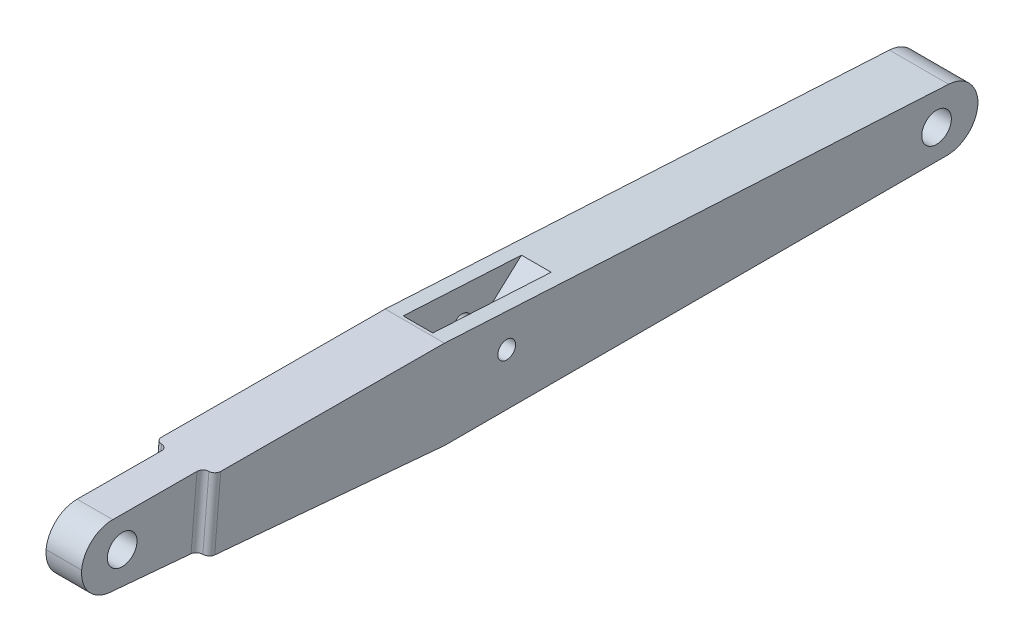
from build123d import *

# Parameters (mm, degrees)
SKETCH2_W           = 10
SKETCH2_H           = 90
BOSS_EXTRUDE1_DEPTH = 10
SKETCH3_W           = 10
SKETCH3_H           = 60
BOSS_EXTRUDE2_DEPTH = 10
BOSS_EXTRUDE3_DEPTH = 10
CUT_EXTRUDE5_START  = -8
CUT_EXTRUDE5_DEPTH  = 2
CUT_EXTRUDE6_DEPTH  = 2
SKETCH4_3_R         = 2.5
CUT_EXTRUDE1_DEPTH  = 10
CUT_EXTRUDE2_START  = -2.5
SKETCH4_5_R         = 1.5
CUT_EXTRUDE2_DEPTH  = 5
CUT_EXTRUDE3_DEPTH  = 107.338519192
FILLET3_R           = 5.25
FILLET4_R           = 5.25
SKETCH4_7_R         = 2.5
CUT_EXTRUDE4_DEPTH  = 106.904850242
FILLET5_R           = 1


# Some blends are built 0.0001 mm under size
with BuildPart() as part:
    # Sketch2 → Boss-Extrude1 (new body)
    with BuildSketch(Plane(origin=(0, 0, 0), x_dir=(1, 0, 0), z_dir=(0, 1, 0))):
        Rectangle(SKETCH2_W, SKETCH2_H)
    extrude(amount=BOSS_EXTRUDE1_DEPTH)

    # Sketch3 → Boss-Extrude2 (add)
    with BuildSketch(Plane(origin=(0, -3.907083998, 0.341825557), x_dir=(1, 0, 0), z_dir=(0, -0.9961946980917459, 0.08715574274765504))):
        with Locations((0, 74.828761414)):
            Rectangle(SKETCH3_W, SKETCH3_H)
    extrude(amount=-BOSS_EXTRUDE2_DEPTH)

    # Sketch4 → Boss-Extrude3 (add)
    with BuildSketch(Plane(origin=(5, 0, 0), x_dir=(0, 0, -1), z_dir=(1, 0, 0))):
        Polygon((-103.900124458, 15.191291546), (-44.563390571, 10), (45, 10), (-45.073853215, 14.973874535), align=None)
    extrude(amount=-BOSS_EXTRUDE3_DEPTH)

    # Sketch6 → Cut-Extrude5 (cut)
    with BuildSketch(Plane(origin=(5, 0, 0), x_dir=(0, 0, -1), z_dir=(1, 0, 0)).offset(CUT_EXTRUDE5_START)):
        Polygon((-103.900124458, 15.191291546), (-104.771681886, 5.229344565), (-84.847787924, 3.48622971), (-83.830217328, 15.117114837), align=None)
    extrude(amount=-CUT_EXTRUDE5_DEPTH, mode=Mode.SUBTRACT)

    # Sketch6<2> → Cut-Extrude6 (cut)
    with BuildSketch(Plane(origin=(5, 0, 0), x_dir=(0, 0, -1), z_dir=(1, 0, 0))):
        Polygon((-103.900124458, 15.191291546), (-104.771681886, 5.229344565), (-84.847787924, 3.48622971), (-83.830217328, 15.117114837), align=None)
    extrude(amount=-CUT_EXTRUDE6_DEPTH, mode=Mode.SUBTRACT)

    # Sketch4<3> → Cut-Extrude1 (cut)
    with BuildSketch(Plane(origin=(5, 0, 0), x_dir=(0, 0, -1), z_dir=(1, 0, 0))):
        with Locations((-97.467522719, 10)):
            Circle(SKETCH4_3_R)
    extrude(amount=-CUT_EXTRUDE1_DEPTH, mode=Mode.SUBTRACT)

    # Sketch4<5> → Cut-Extrude2 (cut)
    with BuildSketch(Plane(origin=(5, 0, 0), x_dir=(0, 0, -1), z_dir=(1, 0, 0)).offset(CUT_EXTRUDE2_START)):
        with BuildLine():
            Line((-44.537121893, 14.944236253), (-36.742124975, 6.709179338))
            ThreePointArc((-36.742124975, 6.709179338), (-34.672491645, 5.773472347), (-32.540320007, 6.556271045))
            Line((-32.540320007, 6.556271045), (-24.563390571, 13.841287616))
            Line((-24.563390571, 13.841287616), (-44.537121893, 14.944236253))
        make_face()
        with Locations((-34.563390571, 8.77148785)):
            Circle(SKETCH4_5_R, mode=Mode.SUBTRACT)
    extrude(amount=-CUT_EXTRUDE2_DEPTH, mode=Mode.SUBTRACT)

    # Sketch4<6> → Cut-Extrude3 (cut, through all)
    with BuildSketch(Plane(origin=(5, 0, 0), x_dir=(0, 0, -1), z_dir=(1, 0, 0))):
        with BuildLine():
            ThreePointArc((-33.702717638, 10), (-34.563390571, 10.27148785), (-35.424063503, 10))
            Line((-35.424063503, 10), (-33.702717638, 10))
        make_face()
        with BuildLine():
            Line((-33.702717638, 10), (-35.424063503, 10))
            ThreePointArc((-35.424063503, 10), (-35.255846563, 7.440884716), (-33.063390571, 8.77148785))
            ThreePointArc((-33.063390571, 8.77148785), (-33.232787437, 9.463943842), (-33.702717638, 10))
        make_face()
    extrude(amount=-CUT_EXTRUDE3_DEPTH, mode=Mode.SUBTRACT)

    # Fillet3
    # the kernel refuses this fillet: 5.25 mm, written as the material it takes off along each edge
    with BuildSketch(Plane(origin=(16.125, 5.229344565, 104.771681886), x_dir=(0, -0.08715574274765522, -0.9961946980917458), z_dir=(-1, 0, 0))) as fillet3_piece_1:
        with BuildLine():
            CenterArc((FILLET3_R, -FILLET3_R), FILLET3_R, 90, 90)
            Line((0, -FILLET3_R), (0, 0))
            Line((0, 0), (FILLET3_R, 0))
        make_face()
    extrude(amount=32.25, mode=Mode.SUBTRACT)
    with BuildSketch(Plane(origin=(15.07154221, 15.191291546, 103.900124458), x_dir=(0, -0.003695891671652919, -0.9999931701690523), z_dir=(-1, 0, 0))) as fillet3_piece_2:
        with BuildLine():
            CenterArc((FILLET3_R * 0.91973654932, FILLET3_R), FILLET3_R, 184.788240524, 85.211759476)
            Line((-FILLET3_R * 0.0767734631138, FILLET3_R * 0.916526680199), (0, 0))
            Line((0, 0), (FILLET3_R * 0.91973654932, 0))
        make_face()
    extrude(amount=30.14308442, mode=Mode.SUBTRACT)

    # Fillet4
    # the kernel refuses this fillet: 5.25 mm, written as the material it takes off along each edge
    with BuildSketch(Plane(origin=(-18.125, 0, -45), x_dir=(0, 1, 0), z_dir=(1, 0, 0))) as fillet4_piece_1:
        with BuildLine():
            CenterArc((FILLET4_R, FILLET4_R), FILLET4_R, 180, 90)
            Line((0, FILLET4_R), (0, 0))
            Line((0, 0), (FILLET4_R, 0))
        make_face()
    extrude(amount=36.25, mode=Mode.SUBTRACT)
    with BuildSketch(Plane(origin=(-17.420233463, 10, -45), x_dir=(0, -1, 0), z_dir=(1, 0, 0))) as fillet4_piece_2:
        with BuildLine():
            CenterArc((FILLET4_R * 0.946303501909, -FILLET4_R), FILLET4_R, 90, 86.839339304)
            Line((-FILLET4_R * 0.0521753539947, -FILLET4_R * 0.944864037923), (0, 0))
            Line((0, 0), (FILLET4_R * 0.946303501909, 0))
        make_face()
    extrude(amount=34.840466925, mode=Mode.SUBTRACT)

    # Sketch4<7> → Cut-Extrude4 (cut, through all)
    with BuildSketch(Plane(origin=(5, 0, 0), x_dir=(0, 0, -1), z_dir=(1, 0, 0))):
        with Locations((38, 5)):
            Circle(SKETCH4_7_R)
    extrude(amount=-CUT_EXTRUDE4_DEPTH, mode=Mode.SUBTRACT)

    # Fillet5
    fillet5_edges = [part.edges().sort_by_distance(p)[0] for p in [
        (-3, 9.301672273, 84.339002626),
        (-5, 9.301672273, 84.339002626),
        (3, 9.301672273, 84.339002626),
        (5, 9.301672273, 84.339002626),
    ]]
    fillet(fillet5_edges, radius=FILLET5_R - 0.0001)  # a hair under: the kernel refuses the full size


solid = part.part
